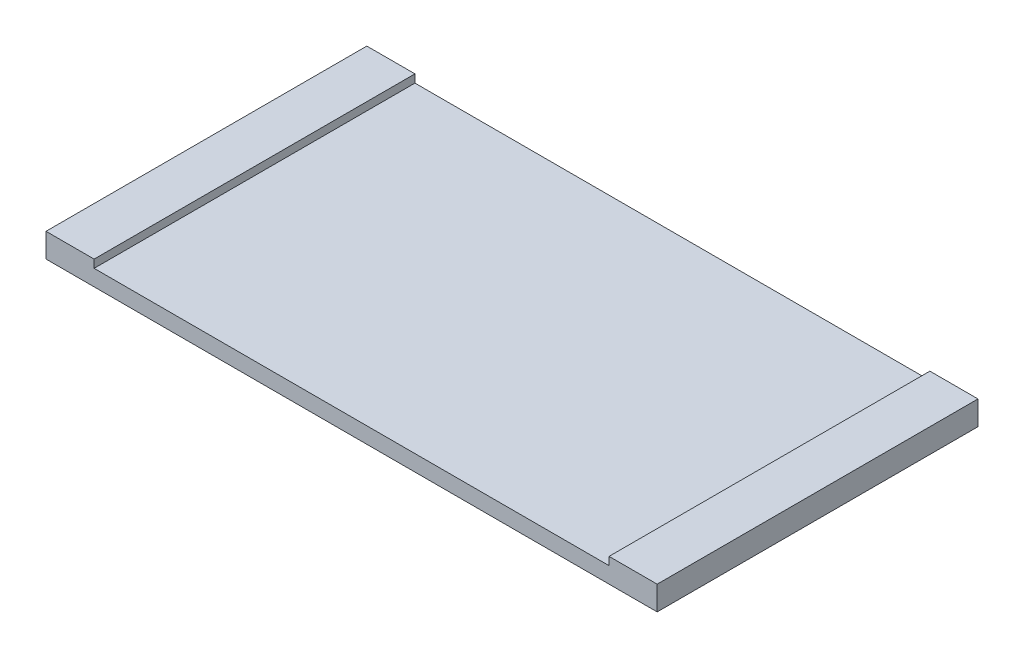
from build123d import *

# Parameters (mm, degrees)
SKETCH1_W           = 76.2
SKETCH1_H           = 40
BOSS_EXTRUDE1_DEPTH = 3
SKETCH2_W           = 64.2
SKETCH2_H           = 40
CUT_EXTRUDE1_DEPTH  = 1


with BuildPart() as part:
    # Sketch1 → Boss-Extrude1 (new body)
    with BuildSketch(Plane(origin=(0, 0, 0), x_dir=(1, 0, 0), z_dir=(0, 1, 0))):
        with Locations((38.1, 20)):
            Rectangle(SKETCH1_W, SKETCH1_H)
    extrude(amount=BOSS_EXTRUDE1_DEPTH)

    # Sketch2 → Cut-Extrude1 (cut)
    with BuildSketch(Plane(origin=(0, 3, 0), x_dir=(1, 0, 0), z_dir=(0, 1, 0))):
        with Locations((38.1, 20)):
            Rectangle(SKETCH2_W, SKETCH2_H)
    extrude(amount=-CUT_EXTRUDE1_DEPTH, mode=Mode.SUBTRACT)


solid = part.part
